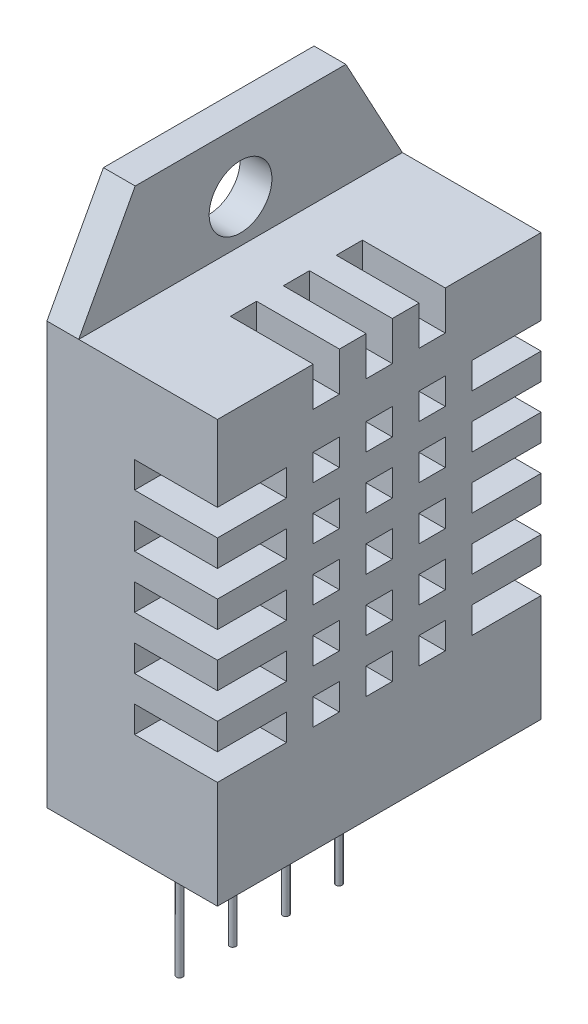
from build123d import *

# Parameters (mm, degrees)
SKETCH1_W           = 15.47
SKETCH1_H           = 20.15
BOSS_EXTRUDE1_DEPTH = 8.15
SKETCH1_4_R         = 1.5
SKETCH1_4_W         = 15.47
SKETCH1_4_H         = 20.15
BOSS_EXTRUDE2_DEPTH = 1.52
SHELL1_START        = -6.455
SHELL1_OUTLINE_W    = 5.59
SHELL1_OUTLINE_H    = 17.59
SHELL1_DEPTH        = 12.91
SKETCH2_W           = 1.25
SKETCH2_H           = 1.87
SKETCH2_H_2         = 1.264229858
SKETCH2_W_2         = 3.3
CUT_EXTRUDE1_DEPTH  = 3.96
SKETCH3_R           = 0.15
BOSS_EXTRUDE3_DEPTH = 7.8


# Read off the part's stored shape, not the designer's step: Shell1
with BuildPart() as part:
    # Sketch1 → Boss-Extrude1 (new body)
    with BuildSketch(Plane(origin=(0, 0, 0), x_dir=(0, 0, -1), z_dir=(1, 0, 0))):
        with Locations((0, -2.5)):
            Rectangle(SKETCH1_W, SKETCH1_H)
    extrude(amount=BOSS_EXTRUDE1_DEPTH)

    # Sketch1<4> → Boss-Extrude2 (add)
    # profile 1 of 2: a face of its own
    with BuildSketch(Plane(origin=(0, 0, 0), x_dir=(0, 0, -1), z_dir=(1, 0, 0))):
        Polygon((-5.035, 12.575), (-7.735, 7.575), (7.735, 7.575), (5.035, 12.575), align=None)
        with Locations((0, 9.615)):
            Circle(SKETCH1_4_R, mode=Mode.SUBTRACT)
    # profile 2 of 2: a face of its own
    with BuildSketch(Plane(origin=(0, 0, 0), x_dir=(0, 0, -1), z_dir=(1, 0, 0))):
        with Locations((0, -2.5)):
            Rectangle(SKETCH1_4_W, SKETCH1_4_H)
    extrude(amount=BOSS_EXTRUDE2_DEPTH)

    # Shell1 outline → Shell1 (cut)
    with BuildSketch(Plane.XY.offset(SHELL1_START)):
        with Locations((4.075, -2.5)):
            Rectangle(SHELL1_OUTLINE_W, SHELL1_OUTLINE_H)
    extrude(amount=SHELL1_DEPTH, mode=Mode.SUBTRACT)

    # Sketch2 → Cut-Extrude1 (cut)
    with BuildSketch(Plane(origin=(8.15, 0, 0), x_dir=(0, 0, -1), z_dir=(1, 0, 0))):
        with Locations((0, 6.64)):
            Rectangle(SKETCH2_W, SKETCH2_H)
        with Locations((2.53, 6.64)):
            Rectangle(SKETCH2_W, SKETCH2_H)
        with Locations((2.53, 0.772885071)):
            Rectangle(SKETCH2_W, SKETCH2_H_2)
        with Locations((6.085, 0.772885071)):
            Rectangle(SKETCH2_W_2, SKETCH2_H_2)
        with Locations((6.085, 3.302885071)):
            Rectangle(SKETCH2_W_2, SKETCH2_H_2)
        with Locations((0, 3.302885071)):
            Rectangle(SKETCH2_W, SKETCH2_H_2)
        with Locations((-2.53, 0.772885071)):
            Rectangle(SKETCH2_W, SKETCH2_H_2)
        with Locations((-2.53, 3.302885071)):
            Rectangle(SKETCH2_W, SKETCH2_H_2)
        with Locations((-6.085, 3.302885071)):
            Rectangle(SKETCH2_W_2, SKETCH2_H_2)
        with Locations((-6.085, 0.772885071)):
            Rectangle(SKETCH2_W_2, SKETCH2_H_2)
        with Locations((-6.085, -1.757114929)):
            Rectangle(SKETCH2_W_2, SKETCH2_H_2)
        with Locations((-6.085, -4.287114929)):
            Rectangle(SKETCH2_W_2, SKETCH2_H_2)
        with Locations((-2.53, -1.757114929)):
            Rectangle(SKETCH2_W, SKETCH2_H_2)
        with Locations((0, -1.757114929)):
            Rectangle(SKETCH2_W, SKETCH2_H_2)
        with Locations((2.53, -1.757114929)):
            Rectangle(SKETCH2_W, SKETCH2_H_2)
        with Locations((6.085, -1.757114929)):
            Rectangle(SKETCH2_W_2, SKETCH2_H_2)
        with Locations((6.085, -4.287114929)):
            Rectangle(SKETCH2_W_2, SKETCH2_H_2)
        with Locations((2.53, -4.287114929)):
            Rectangle(SKETCH2_W, SKETCH2_H_2)
        with Locations((0, -4.287114929)):
            Rectangle(SKETCH2_W, SKETCH2_H_2)
        with Locations((-2.53, -4.287114929)):
            Rectangle(SKETCH2_W, SKETCH2_H_2)
        with Locations((6.085, -6.817114929)):
            Rectangle(SKETCH2_W_2, SKETCH2_H_2)
        with Locations((2.53, -6.817114929)):
            Rectangle(SKETCH2_W, SKETCH2_H_2)
        with Locations((-2.53, -6.817114929)):
            Rectangle(SKETCH2_W, SKETCH2_H_2)
        with Locations((-6.085, -6.817114929)):
            Rectangle(SKETCH2_W_2, SKETCH2_H_2)
        with Locations((-2.53, 6.64)):
            Rectangle(SKETCH2_W, SKETCH2_H)
        with Locations((2.53, 3.302885071)):
            Rectangle(SKETCH2_W, SKETCH2_H_2)
        with Locations((0, 0.772885071)):
            Rectangle(SKETCH2_W, SKETCH2_H_2)
        with Locations((0, -6.817114929)):
            Rectangle(SKETCH2_W, SKETCH2_H_2)
    extrude(amount=-CUT_EXTRUDE1_DEPTH, mode=Mode.SUBTRACT)

    # Sketch3 → Boss-Extrude3 (add)
    with BuildSketch(Plane.XZ.offset(12.575)):
        with Locations(Location((2.31, 3.704312159, 0), (0, 0, 90))):
            Circle(SKETCH3_R)
        with Locations(Location((2.31, 1.164312159, 0), (0, 0, 90))):
            Circle(SKETCH3_R)
        with Locations(Location((2.31, -1.375687841, 0), (0, 0, 90))):
            Circle(SKETCH3_R)
        with Locations(Location((2.31, -3.915687841, 0), (0, 0, 90))):
            Circle(SKETCH3_R)
    extrude(amount=BOSS_EXTRUDE3_DEPTH)


solid = part.part
